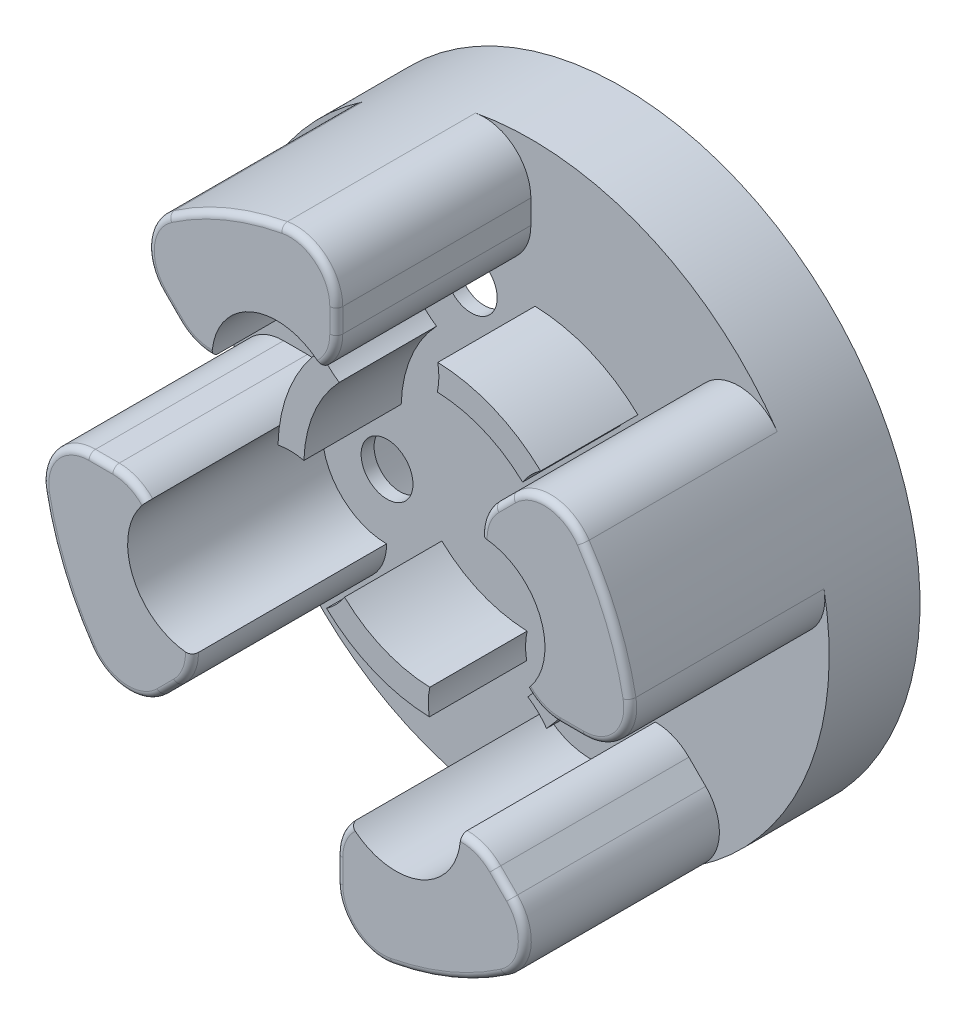
from build123d import *
from build123d.topology import SkipClean

# Parameters (mm, degrees)
SKETCH1_R           = 11.5
BOSS_EXTRUDE1_DEPTH = 1
BOSS_EXTRUDE2_DEPTH = 7.5
BOSS_EXTRUDE4_START = 2.5
SKETCH9_R           = 11.5
BOSS_EXTRUDE4_DEPTH = 2.5
FILLET7_R           = 1.8
SKETCH15_R          = 8.025
CUT_EXTRUDE7_DEPTH  = 3
SKETCH17_R          = 6
SKETCH17_R_2        = 5
BOSS_EXTRUDE7_DEPTH = 3.75
FILLET8_R           = 0.25
SKETCH21_R          = 2.5000000000000004
CUT_EXTRUDE9_DEPTH  = 10
SKETCH22_R          = 1.0000000000000002
CUT_EXTRUDE10_DEPTH = 10
CIRPATTERN5_COUNT   = 4
CIRPATTERN6_COUNT   = 4


with BuildPart() as part:
    # Sketch1 → Boss-Extrude1 (new body)
    with BuildSketch(Plane.XY):
        Circle(SKETCH1_R)
    extrude(amount=BOSS_EXTRUDE1_DEPTH)

    # Sketch3 → Boss-Extrude2 (add)
    with SkipClean():  # the faces are left unmerged after this step: merging them gives an invalid solid
        with BuildSketch(Plane.XY.offset(1)):
            with BuildLine():
                Line((2.94e-15, 11.5), (2.39e-15, 7))
                ThreePointArc((2.39e-15, 7), (-2.678784026555645, 6.467156727579), (-4.94974746830586, 4.949747468305805))
                Line((-4.94974746830586, 4.949747468305805), (-8.131727983645343, 8.13172798364525))
                ThreePointArc((-8.131727983645343, 8.13172798364525), (-4.40085947219856, 10.624614623879786), (2.94e-15, 11.5))
            make_face()
            with BuildLine():
                Line((11.5, -2.94e-15), (7, -2.39e-15))
                ThreePointArc((7, -2.39e-15), (6.467156727578999, 2.678784026555647), (4.949747468305803, 4.949747468305863))
                Line((4.949747468305803, 4.949747468305863), (8.131727983645245, 8.131727983645348))
                ThreePointArc((8.131727983645245, 8.131727983645348), (10.624614623879785, 4.400859472198563), (11.5, -2.94e-15))
            make_face()
            with BuildLine():
                Line((-4.949747468305786, -4.94974746830588), (-8.13172798364522, -8.131727983645371))
                ThreePointArc((-8.13172798364522, -8.131727983645371), (-10.624614623879776, -4.400859472198586), (-11.5, -2.94e-15))
                Line((-11.5, -2.94e-15), (-7, -2.39e-15))
                ThreePointArc((-7, -2.39e-15), (-6.467156727578994, -2.6787840265556606), (-4.949747468305786, -4.94974746830588))
            make_face()
            with BuildLine():
                Line((2.39e-15, -7), (2.94e-15, -11.5))
                ThreePointArc((2.94e-15, -11.5), (4.4008594721985705, -10.624614623879783), (8.13172798364535, -8.131727983645241))
                Line((8.13172798364535, -8.131727983645241), (4.949747468305866, -4.949747468305799))
                ThreePointArc((4.949747468305866, -4.949747468305799), (2.6787840265556517, -6.467156727578998), (2.39e-15, -7))
            make_face()
        extrude(amount=BOSS_EXTRUDE2_DEPTH)

    # Sketch9 → Boss-Extrude4 (add)
    with SkipClean():  # the faces are left unmerged after this step: merging them gives an invalid solid
        with BuildSketch(Plane(origin=(0, 0, 0), x_dir=(-1, 0, 0), z_dir=(0, 0, -1)).offset(BOSS_EXTRUDE4_START)):
            Circle(SKETCH9_R)
        extrude(amount=-BOSS_EXTRUDE4_DEPTH)

    # Fillet7
    # the kernel refuses this fillet: 1.8 mm, written as the material it takes off along each edge
    with BuildSketch(Plane(origin=(-11.5, -3.47e-15, 1), x_dir=(0.09318902325471962, -0.9956484349130628, 0), z_dir=(0, 0, 1))) as fillet7_piece_1:
        with BuildLine():
            CenterArc((1.9756072930000665, 1.7921671828435137), FILLET7_R, 174.6529039393069, 100.69419212138632)
            Line((0.18344011015655334, 1.9599074247020072), (0, 0))
            ThreePointArc((0, 0), (1.0716737674292827, -0.05004299849978115), (2.1433475348585644, 0))
        make_face()
    extrude(amount=12.858368837146411, mode=Mode.SUBTRACT)
    with BuildSketch(Plane(origin=(-8.13172798364522, -8.131727983645371, 1), x_dir=(-0.6381351697292437, 0.7699243502803567, 0), z_dir=(0, 0, 1))) as fillet7_piece_2:
        with BuildLine():
            CenterArc((1.9756072930000672, -1.792167182843513), FILLET7_R, 84.6529039393068, 100.69419212138638)
            Line((0.1834401101565546, -1.9599074247020083), (0, 0))
            ThreePointArc((0, 0), (1.0716737674292829, 0.05004299849977712), (2.143347534858564, -1.7e-16))
        make_face()
    extrude(amount=12.85836883714641, mode=Mode.SUBTRACT)
    with BuildSketch(Plane(origin=(-4.9497474683057865, -4.94974746830588, 1), x_dir=(-0.7071067811865409, -0.7071067811865541, 0), z_dir=(0, 0, 1))) as fillet7_piece_3:
        with BuildLine():
            CenterArc((1.6139421869432105, -1.8), FILLET7_R, 89.99999999999999, 78.1971083096929)
            ThreePointArc((-0.1480005331133559, -1.4318181818181808), (-0.03709844001056889, -0.7197234648785187), (0, 0))
            Line((0, 0), (1.613942186943211, -5e-17))
        make_face()
    extrude(amount=11.534855467358028, mode=Mode.SUBTRACT)
    with BuildSketch(Plane(origin=(-7, -2.39e-15, 1), x_dir=(0.10281763783979006, -0.9947002228556329, 0), z_dir=(0, 0, 1))) as fillet7_piece_4:
        with BuildLine():
            CenterArc((1.6245186778686538, -1.7904604011401397), FILLET7_R, 95.90144584515348, 78.19710830969298)
            Line((-0.1659417232714857, -1.605388653028521), (0, 0))
            ThreePointArc((0, 0), (0.719723464878518, -0.0370984400105693), (1.4394469297570365, -1e-17))
        make_face()
    extrude(amount=11.53485546735803, mode=Mode.SUBTRACT)
    with BuildSketch(Plane(origin=(11.5, -1.91e-15, 1), x_dir=(-0.09318902325471963, 0.9956484349130628, 0), z_dir=(0, 0, 1))) as fillet7_piece_5:
        with BuildLine():
            CenterArc((1.9756072930000679, 1.7921671828435135), FILLET7_R, 174.65290393930684, 100.69419212138632)
            Line((0.1834401101565547, 1.959907424702009), (0, 0))
            ThreePointArc((0, 0), (1.071673767429282, -0.05004299849977752), (2.143347534858564, 1e-17))
        make_face()
    extrude(amount=12.85836883714641, mode=Mode.SUBTRACT)
    with BuildSketch(Plane(origin=(8.131727983645245, 8.131727983645348, 1), x_dir=(0.6381351697292414, -0.7699243502803585, 0), z_dir=(0, 0, 1))) as fillet7_piece_6:
        with BuildLine():
            CenterArc((1.9756072930000685, -1.7921671828435133), FILLET7_R, 84.65290393930678, 100.69419212138632)
            Line((0.18344011015655537, -1.9599074247020083), (0, 0))
            ThreePointArc((0, 0), (1.0716737674292818, 0.05004299849977642), (2.1433475348585658, 1e-16))
        make_face()
    extrude(amount=12.858368837146415, mode=Mode.SUBTRACT)
    with BuildSketch(Plane(origin=(4.949747468305803, 4.949747468305864, 1), x_dir=(0.7071067811865431, 0.7071067811865519, 0), z_dir=(0, 0, 1))) as fillet7_piece_7:
        with BuildLine():
            CenterArc((1.6139421869432122, -1.8000000000000003), FILLET7_R, 90.00000000000006, 78.19710830969285)
            ThreePointArc((-0.1480005331133539, -1.4318181818181812), (-0.03709844001056789, -0.7197234648785188), (0, 0))
            Line((0, 0), (1.6139421869432107, 9e-17))
        make_face()
    extrude(amount=11.534855467358028, mode=Mode.SUBTRACT)
    with BuildSketch(Plane(origin=(7.000000000000001, -2.39e-15, 1), x_dir=(-0.10281763783978815, 0.9947002228556331, 0), z_dir=(0, 0, 1))) as fillet7_piece_8:
        with BuildLine():
            CenterArc((1.6245186778686564, -1.7904604011401393), FILLET7_R, 95.90144584515355, 78.19710830969294)
            Line((-0.1659417232714833, -1.6053886530285206), (0, 0))
            ThreePointArc((0, 0), (0.7197234648785186, -0.03709844001056886), (1.4394469297570374, 1e-17))
        make_face()
    extrude(amount=11.53485546735803, mode=Mode.SUBTRACT)
    with BuildSketch(Plane(origin=(2.94e-15, -11.5, 1), x_dir=(0.9956484349130625, 0.09318902325472045, 0), z_dir=(0, 0, 1))) as fillet7_piece_9:
        with BuildLine():
            CenterArc((1.9756072930000688, 1.7921671828435133), FILLET7_R, 174.65290393930678, 100.69419212138638)
            Line((0.18344011015655606, 1.9599074247020103), (0, 0))
            ThreePointArc((0, 0), (1.0716737674292822, -0.05004299849977666), (2.143347534858564, -3e-17))
        make_face()
    extrude(amount=12.858368837146411, mode=Mode.SUBTRACT)
    with BuildSketch(Plane(origin=(8.131727983645348, -8.131727983645241, 1), x_dir=(-0.7699243502803581, -0.6381351697292419, 0), z_dir=(0, 0, 1))) as fillet7_piece_10:
        with BuildLine():
            CenterArc((1.9756072930000643, -1.7921671828435122), FILLET7_R, 84.65290393930678, 100.69419212138632)
            Line((0.1834401101565515, -1.9599074247020072), (0, 0))
            ThreePointArc((0, 0), (1.0716737674292809, 0.05004299849977881), (2.1433475348585613, 1.5e-16))
        make_face()
    extrude(amount=12.858368837146404, mode=Mode.SUBTRACT)
    with BuildSketch(Plane(origin=(4.949747468305867, -4.9497474683058, 1), x_dir=(0.7071067811865519, -0.7071067811865431, 0), z_dir=(0, 0, 1))) as fillet7_piece_11:
        with BuildLine():
            CenterArc((1.6139421869432136, -1.8), FILLET7_R, 90.00000000000001, 78.19710830969295)
            ThreePointArc((-0.1480005331133532, -1.4318181818181832), (-0.03709844001056726, -0.7197234648785195), (0, 0))
            Line((0, 0), (1.6139421869432133, 3e-17))
        make_face()
    extrude(amount=11.534855467358033, mode=Mode.SUBTRACT)
    with BuildSketch(Plane(origin=(2.69e-15, -7.000000000000001, 1), x_dir=(0.9947002228556331, 0.1028176378397881, 0), z_dir=(0, 0, 1))) as fillet7_piece_12:
        with BuildLine():
            CenterArc((1.624518677868658, -1.7904604011401393), FILLET7_R, 95.90144584515357, 78.19710830969288)
            Line((-0.16594172327148143, -1.6053886530285206), (0, 0))
            ThreePointArc((0, 0), (0.7197234648785191, -0.03709844001056889), (1.439446929757038, -1e-17))
        make_face()
    extrude(amount=11.53485546735803, mode=Mode.SUBTRACT)
    with BuildSketch(Plane(origin=(3.47e-15, 11.5, 1), x_dir=(-0.9956484349130628, -0.09318902325471957, 0), z_dir=(0, 0, 1))) as fillet7_piece_13:
        with BuildLine():
            CenterArc((1.975607293000068, 1.7921671828435135), FILLET7_R, 174.65290393930684, 100.69419212138638)
            Line((0.18344011015655504, 1.9599074247020087), (0, 0))
            ThreePointArc((0, 0), (1.0716737674292829, -0.05004299849977933), (2.1433475348585658, 0))
        make_face()
    extrude(amount=12.858368837146413, mode=Mode.SUBTRACT)
    with BuildSketch(Plane(origin=(-8.131727983645344, 8.131727983645252, 1), x_dir=(0.76992435028036, 0.6381351697292397, 0), z_dir=(0, 0, 1))) as fillet7_piece_14:
        with BuildLine():
            CenterArc((1.9756072930000717, -1.7921671828435126), FILLET7_R, 84.65290393930685, 100.6941921213865)
            Line((0.18344011015655898, -1.959907424702013), (0, 0))
            ThreePointArc((0, 0), (1.071673767429283, 0.0500429984997777), (2.143347534858566, -1.9e-16))
        make_face()
    extrude(amount=12.858368837146417, mode=Mode.SUBTRACT)
    with BuildSketch(Plane(origin=(-4.94974746830586, 4.949747468305805, 1), x_dir=(-0.7071067811865517, 0.7071067811865435, 0), z_dir=(0, 0, 1))) as fillet7_piece_15:
        with BuildLine():
            CenterArc((1.6139421869432118, -1.7999999999999996), FILLET7_R, 90.00000000000001, 78.1971083096929)
            ThreePointArc((-0.148000533113354, -1.4318181818181808), (-0.03709844001056821, -0.719723464878517), (0, 0))
            Line((0, 0), (1.6139421869432116, 2e-17))
        make_face()
    extrude(amount=11.534855467358028, mode=Mode.SUBTRACT)
    with BuildSketch(Plane(origin=(2.39e-15, 7, 1), x_dir=(-0.9947002228556331, -0.10281763783978815, 0), z_dir=(0, 0, 1))) as fillet7_piece_16:
        with BuildLine():
            CenterArc((1.6245186778686564, -1.7904604011401402), FILLET7_R, 95.90144584515355, 78.19710830969288)
            Line((-0.1659417232714832, -1.6053886530285197), (0, 0))
            ThreePointArc((0, 0), (0.7197234648785187, -0.03709844001056797), (1.4394469297570374, -1e-17))
        make_face()
    extrude(amount=11.534855467358028, mode=Mode.SUBTRACT)

    # Sketch15 → Cut-Extrude7 (cut)
    with BuildSketch(Plane(origin=(0, 0, -2.5), x_dir=(-1, 0, 0), z_dir=(0, 0, -1))):
        Circle(SKETCH15_R)
    extrude(amount=-CUT_EXTRUDE7_DEPTH, mode=Mode.SUBTRACT)

    # Sketch17 → Boss-Extrude7 (add)
    with BuildSketch(Plane.XY.offset(1)):
        Circle(SKETCH17_R)
        Circle(SKETCH17_R_2, mode=Mode.SUBTRACT)
    extrude(amount=BOSS_EXTRUDE7_DEPTH)

    # Fillet8
    fillet8_edges = [part.edges().sort_by_distance(p)[0] for p in [
        (9.072734411136402, -2.64e-15, 8.5),
        (6.415392026018866, 6.415392026018946, 8.5),
        (6.467156727578926, 2.678784026555827, 8.5),
        (8.180339566895455, 7.259182095609021, 8.5),
        (5.573308738132088, 5.0032564751122734, 8.5),
        (7.478760983946551, 0.40308782081246686, 8.5),
        (10.917390465833716, 0.6513566944870959, 8.5),
        (2.64e-15, 9.072734411136402, 8.5),
        (-2.6787840265558276, 6.4671567275789235, 8.5),
        (-4.4008594721986185, 10.624614623879763, 8.5),
        (-6.415392026018942, 6.4153920260188695, 8.5),
        (-0.6513566944870959, 10.917390465833716, 8.5),
        (-5.0032564751122734, 5.573308738132088, 8.5),
        (-7.259182095609021, 8.180339566895455, 8.5),
        (-0.40308782081246686, 7.478760983946551, 8.5),
        (-9.072734411136402, -2.64e-15, 8.5),
        (-6.467156727578924, -2.678784026555827, 8.5),
        (-10.624614623879765, -4.400859472198617, 8.5),
        (-6.415392026018846, -6.415392026018966, 8.5),
        (-5.573308738132088, -5.0032564751122734, 8.5),
        (-8.180339566895455, -7.259182095609021, 8.5),
        (-10.917390465833716, -0.6513566944870959, 8.5),
        (-7.478760983946551, -0.40308782081246686, 8.5),
        (10.624614623879765, 4.400859472198618, 8.5),
        (4.4008594721986185, -10.624614623879761, 8.5),
        (2.64e-15, -9.072734411136402, 8.5),
        (2.678784026555829, -6.467156727578926, 8.5),
        (6.4153920260189485, -6.415392026018862, 8.5),
        (5.0032564751122734, -5.573308738132088, 8.5),
        (7.259182095609021, -8.180339566895455, 8.5),
        (0.6513566944870959, -10.917390465833716, 8.5),
        (0.40308782081246686, -7.478760983946551, 8.5),
    ]]
    fillet(fillet8_edges, radius=FILLET8_R)

    # Sketch21 → Cut-Extrude9 (cut)
    with BuildSketch(Plane.XY.offset(1)):
        with Locations((-2.2961005941905532, 5.543277195067715)):
            Circle(SKETCH21_R)
    cut_extrude9 = extrude(amount=CUT_EXTRUDE9_DEPTH, mode=Mode.SUBTRACT)

    # Sketch22 → Cut-Extrude10 (cut)
    with BuildSketch(Plane.XY.offset(1)):
        with Locations((-2.2961005941905532, 5.543277195067715)):
            Circle(SKETCH22_R)
    cut_extrude10 = extrude(amount=-CUT_EXTRUDE10_DEPTH, mode=Mode.SUBTRACT)

    # CirPattern5: Cut-Extrude9 ×4 about axis
    cirpattern5_axis = Axis((-9.65e-15, -3.9e-15, 0), (0, 0, 1))
    for i in range(1, CIRPATTERN5_COUNT):
        add(cut_extrude9.rotate(cirpattern5_axis, i * 360 / CIRPATTERN5_COUNT), mode=Mode.SUBTRACT)

    # CirPattern6: Cut-Extrude10 ×4 about axis
    cirpattern6_axis = Axis((-9.65e-15, -3.9e-15, 0), (0, 0, 1))
    for i in range(1, CIRPATTERN6_COUNT):
        add(cut_extrude10.rotate(cirpattern6_axis, i * 360 / CIRPATTERN6_COUNT), mode=Mode.SUBTRACT)


solid = part.part
